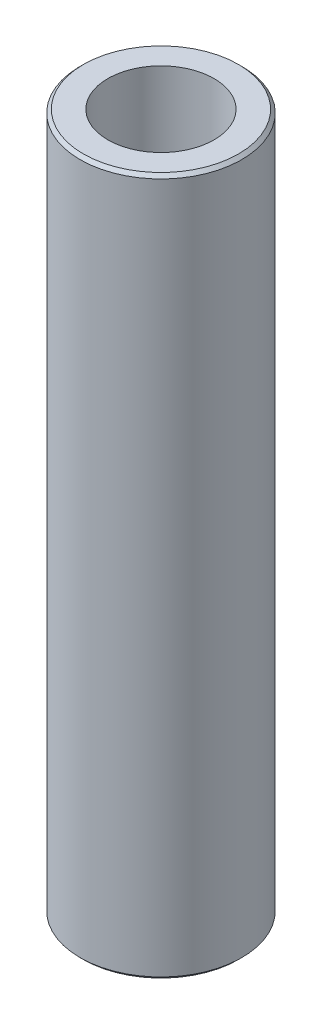
from build123d import *

# Parameters (mm, degrees)
SKETCH1_R           = 15
BOSS_EXTRUDE1_DEPTH = 129.467311492
SKETCH2_R           = 9.860454987
CUT_EXTRUDE1_DEPTH  = 132.193691712
CHAMFER1_SIZE       = 0.607946769


with BuildPart() as part:
    # Sketch1 → Boss-Extrude1 (new body)
    with BuildSketch(Plane(origin=(0, 0, 0), x_dir=(1, 0, 0), z_dir=(0, 1, 0))):
        Circle(SKETCH1_R)
    extrude(amount=BOSS_EXTRUDE1_DEPTH)

    # Sketch2 → Cut-Extrude1 (cut, through all)
    with BuildSketch(Plane(origin=(0, 0, 0), x_dir=(1, 0, 0), z_dir=(0, 1, 0))):
        Circle(SKETCH2_R)
    extrude(amount=CUT_EXTRUDE1_DEPTH, mode=Mode.SUBTRACT)

    # Chamfer1
    chamfer1_edges = [part.edges().sort_by_distance(p)[0] for p in [
        (-15, 129.467311492, 0),
        (-15, 0, 0),
    ]]
    chamfer(chamfer1_edges, length=CHAMFER1_SIZE)


solid = part.part
